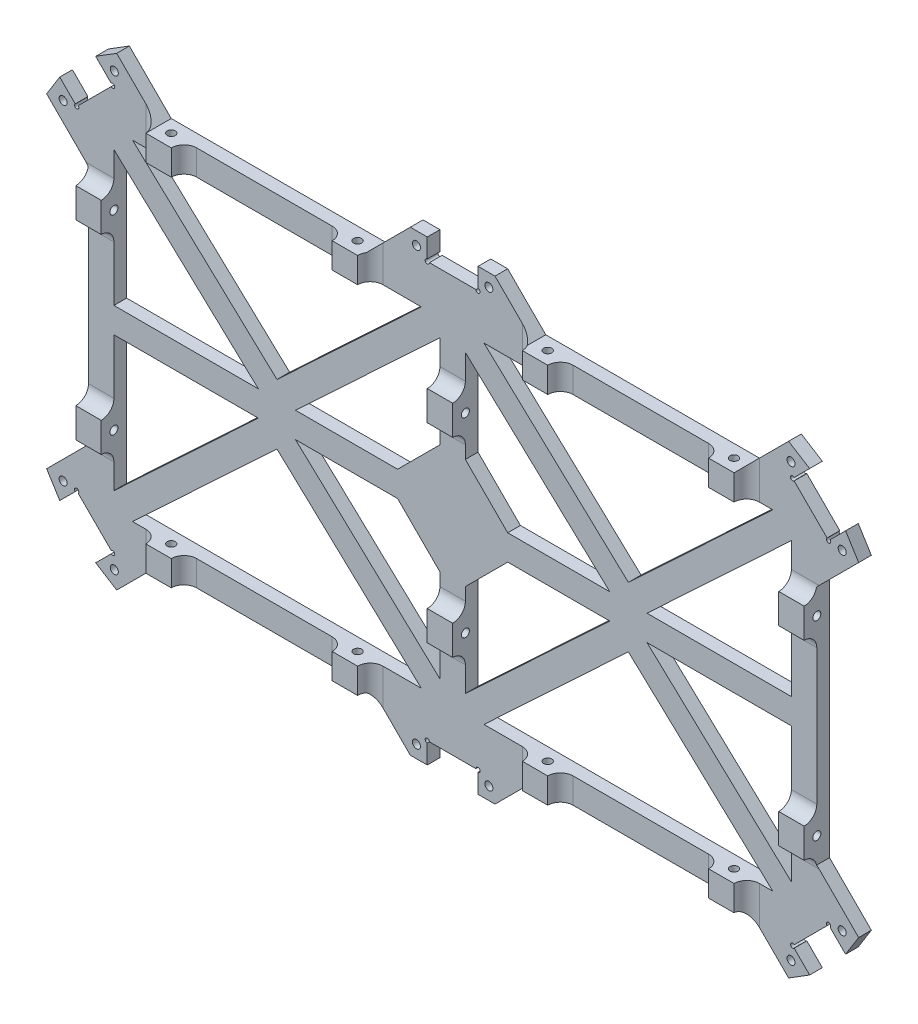
from build123d import *

# Parameters (mm, degrees)
ESQUISSE1_W             = 172
ESQUISSE1_H             = 90
BOSS_EXTRU_1_DEPTH      = 3
ESQUISSE2_R             = 0.95
BOSS_EXTRU_2_DEPTH      = 3
ESQUISSE6_W             = 6
ESQUISSE6_H             = 7
ESQUISSE6_H_2           = 6
BOSS_EXTRU_4_DEPTH      = 3
ENL_V_MAT_EXTRU_3_REACH = 140.593
ESQUISSE7_R             = 0.95
ENL_V_MAT_EXTRU_4_REACH = 140.593
ESQUISSE8_R             = 0.95
CONG_2_R                = 3
ENL_V_MAT_EXTRU_5_REACH = 192.084
ESQUISSE9_R             = 0.95
ENL_V_MAT_EXTRU_6_REACH = 115.259
ESQUISSE10_R            = 0.95
ENL_V_MAT_EXTRU_7_REACH = 186.351
ESQUISSE11_R            = 0.95
ENL_V_MAT_EXTRU_8_REACH = 112.527
ESQUISSE12_W            = 12
ESQUISSE12_H            = 7.192942245
ENL_V_MAT_EXTRU_9_REACH = 112.527
ESQUISSE13_R            = 0.5


with BuildPart() as part:
    # Esquisse1 → Boss.-Extru.1 (new body)
    with BuildSketch(Plane.XY):
        Rectangle(ESQUISSE1_W, ESQUISSE1_H)
        Polygon((-7.392425614, -39), (-75.607574386, -39), (-58.857104999, -23.337223431), (-58.701018232, -23.191272168), (-41.5, -7.107203172), align=None, mode=Mode.SUBTRACT)
        Polygon((-80, -34.892796828), (-80, -3), (-45.892425614, -3), (-62.798981768, -18.808727832), align=None, mode=Mode.SUBTRACT)
        Polygon((-3, -3), (-3, -34.892796828), (-37.107574386, -3), align=None, mode=Mode.SUBTRACT)
        Polygon((41.5, -7.107203172), (58.701018232, -23.191272168), (58.857104999, -23.337223431), (75.607574386, -39), (7.392425614, -39), align=None, mode=Mode.SUBTRACT)
        Polygon((37.107574386, -3), (3, -34.892796828), (3, -3), align=None, mode=Mode.SUBTRACT)
        Polygon((80, -34.892796828), (62.798981768, -18.808727832), (45.892425614, -3), (80, -3), align=None, mode=Mode.SUBTRACT)
        Polygon((-80, 3), (-80, 34.892796828), (-62.798981768, 18.808727832), (-45.892425614, 3), align=None, mode=Mode.SUBTRACT)
        Polygon((-34.550705308, 5.390838618), (-3, 34.892796828), (-3, 3), (-37.107574386, 3), align=None, mode=Mode.SUBTRACT)
        Polygon((-58.857104999, 23.337223431), (-75.607574386, 39), (-7.392425614, 39), (-41.5, 7.107203172), (-58.701018232, 23.191272168), align=None, mode=Mode.SUBTRACT)
        Polygon((3, 3), (3, 34.892796828), (34.550705308, 5.390838618), (37.107574386, 3), align=None, mode=Mode.SUBTRACT)
        Polygon((62.798981768, 18.808727832), (80, 34.892796828), (80, 3), (45.892425614, 3), align=None, mode=Mode.SUBTRACT)
        Polygon((75.607574386, 39), (58.857104999, 23.337223431), (58.701018232, 23.191272168), (41.5, 7.107203172), (7.392425614, 39), align=None, mode=Mode.SUBTRACT)
    extrude(amount=BOSS_EXTRU_1_DEPTH)

    # Esquisse2 → Boss.-Extru.2 (add)
    # profile 1 of 10: a face of its own
    with BuildSketch(Plane.XY.offset(3)):
        Polygon((-86, 45), (-69.45370132, 45), (-79.341722304, 54.888020984), (-89.535533906, 48.535533906), (-95.888020984, 38.341722304), (-86, 28.45370132), align=None)
        with Locations((-92, 38.908474042)):
            Circle(ESQUISSE2_R, mode=Mode.SUBTRACT)
        with Locations((-79.908474042, 51)):
            Circle(ESQUISSE2_R, mode=Mode.SUBTRACT)
    # profile 2 of 10: a face of its own
    with BuildSketch(Plane.XY.offset(3)):
        Polygon((-19, 45), (-10.3, 45), (10.3, 45), (19, 45), (10, 54), (0, 54), (-10, 54), align=None)
        with Locations((-8.55, 51)):
            Circle(ESQUISSE2_R, mode=Mode.SUBTRACT)
        with Locations((8.55, 51)):
            Circle(ESQUISSE2_R, mode=Mode.SUBTRACT)
    # profile 3 of 10: a face of its own
    with BuildSketch(Plane.XY.offset(3)):
        Polygon((79.341722304, 54.888020984), (69.45370132, 45), (86, 45), (86, 28.45370132), (95.888020984, 38.341722304), (89.535533906, 48.535533906), align=None)
        with Locations((92, 38.908474042)):
            Circle(ESQUISSE2_R, mode=Mode.SUBTRACT)
        with Locations((79.908474042, 51)):
            Circle(ESQUISSE2_R, mode=Mode.SUBTRACT)
    # profile 4 of 10: a face of its own
    with BuildSketch(Plane.XY.offset(3)):
        Polygon((95.888020984, -38.341722304), (86, -28.45370132), (86, -45), (69.45370132, -45), (79.341722304, -54.888020984), (89.535533906, -48.535533906), align=None)
        with Locations((79.908474042, -51)):
            Circle(ESQUISSE2_R, mode=Mode.SUBTRACT)
        with Locations((92, -38.908474042)):
            Circle(ESQUISSE2_R, mode=Mode.SUBTRACT)
    # profile 5 of 10: a face of its own
    with BuildSketch(Plane.XY.offset(3)):
        Polygon((19, -45), (-19, -45), (-10, -54), (0, -54), (10, -54), align=None)
        with Locations((-8.55, -51)):
            Circle(ESQUISSE2_R, mode=Mode.SUBTRACT)
        with Locations((8.55, -51)):
            Circle(ESQUISSE2_R, mode=Mode.SUBTRACT)
    # profile 6 of 10: a face of its own
    with BuildSketch(Plane.XY.offset(3)):
        Polygon((-86, -45), (-86, -28.45370132), (-95.888020984, -38.341722304), (-89.535533906, -48.535533906), (-79.341722304, -54.888020984), (-69.45370132, -45), align=None)
        with Locations((-79.908474042, -51)):
            Circle(ESQUISSE2_R, mode=Mode.SUBTRACT)
        with Locations((-92, -38.908474042)):
            Circle(ESQUISSE2_R, mode=Mode.SUBTRACT)
    # profile 7 of 10: a face of its own
    with BuildSketch(Plane.XY.offset(3)):
        Polygon((-3, -3), (-13, -3), (-3, -13), align=None)
    # profile 8 of 10: a face of its own
    with BuildSketch(Plane.XY.offset(3)):
        Polygon((3, -3), (3, -13), (13, -3), align=None)
    # profile 9 of 10: a face of its own
    with BuildSketch(Plane.XY.offset(3)):
        Polygon((13, 3), (3, 13), (3, 3), align=None)
    # profile 10 of 10: a face of its own
    with BuildSketch(Plane.XY.offset(3)):
        Polygon((-3, 13), (-13, 3), (-3, 3), align=None)
    extrude(amount=-BOSS_EXTRU_2_DEPTH)

    # Esquisse6 → Boss.-Extru.4 (add)
    with BuildSketch(Plane.XY.offset(3)):
        with Locations((-83, -22.5)):
            Rectangle(ESQUISSE6_W, ESQUISSE6_H)
        with Locations((-83, 22.5)):
            Rectangle(ESQUISSE6_W, ESQUISSE6_H)
        with Locations((83, -22.5)):
            Rectangle(ESQUISSE6_W, ESQUISSE6_H)
        with Locations((83, 22.5)):
            Rectangle(ESQUISSE6_W, ESQUISSE6_H)
        with Locations((-66.45370132, 42)):
            Rectangle(ESQUISSE6_W, ESQUISSE6_H_2)
        with Locations((22.45370132, 42)):
            Rectangle(ESQUISSE6_W, ESQUISSE6_H_2)
        with Locations((-22.45370132, 42)):
            Rectangle(ESQUISSE6_W, ESQUISSE6_H_2)
        with Locations((66.45370132, 42)):
            Rectangle(ESQUISSE6_W, ESQUISSE6_H_2)
        with Locations((66.45370132, -42)):
            Rectangle(ESQUISSE6_W, ESQUISSE6_H_2)
        with Locations((22.45370132, -42)):
            Rectangle(ESQUISSE6_W, ESQUISSE6_H_2)
        with Locations((-22.45370132, -42)):
            Rectangle(ESQUISSE6_W, ESQUISSE6_H_2)
        with Locations((-66.45370132, -42)):
            Rectangle(ESQUISSE6_W, ESQUISSE6_H_2)
        with Locations((0, 22.5)):
            Rectangle(ESQUISSE6_W, ESQUISSE6_H)
        with Locations((0, -22.5)):
            Rectangle(ESQUISSE6_W, ESQUISSE6_H)
    extrude(amount=BOSS_EXTRU_4_DEPTH)

    # Esquisse7 → Enlèv. mat.-Extru.3 (cut, up to next)
    with BuildSketch(Plane.XZ.offset(45), mode=Mode.PRIVATE) as enl_v_mat_extru_3_sk1:
        with Locations(Location((-66.45370132, 3, 0), (0, 0, 270))):
            Circle(ESQUISSE7_R)
    enl_v_mat_extru_3_tool1 = extrude(enl_v_mat_extru_3_sk1.sketch, amount=-ENL_V_MAT_EXTRU_3_REACH, mode=Mode.PRIVATE) & part.part
    # Esquisse7 → Enlèv. mat.-Extru.3 (cut, up to next)
    with BuildSketch(Plane.XZ.offset(45), mode=Mode.PRIVATE) as enl_v_mat_extru_3_sk2:
        with Locations(Location((-22.45370132, 3, 0), (0, 0, 270))):
            Circle(ESQUISSE7_R)
    enl_v_mat_extru_3_tool2 = extrude(enl_v_mat_extru_3_sk2.sketch, amount=-ENL_V_MAT_EXTRU_3_REACH, mode=Mode.PRIVATE) & part.part
    # Esquisse7 → Enlèv. mat.-Extru.3 (cut, up to next)
    with BuildSketch(Plane.XZ.offset(45), mode=Mode.PRIVATE) as enl_v_mat_extru_3_sk3:
        with Locations(Location((22.45370132, 3, 0), (0, 0, 270))):
            Circle(ESQUISSE7_R)
    enl_v_mat_extru_3_tool3 = extrude(enl_v_mat_extru_3_sk3.sketch, amount=-ENL_V_MAT_EXTRU_3_REACH, mode=Mode.PRIVATE) & part.part
    # Esquisse7 → Enlèv. mat.-Extru.3 (cut, up to next)
    with BuildSketch(Plane.XZ.offset(45), mode=Mode.PRIVATE) as enl_v_mat_extru_3_sk4:
        with Locations(Location((66.45370132, 3, 0), (0, 0, 270))):
            Circle(ESQUISSE7_R)
    enl_v_mat_extru_3_tool4 = extrude(enl_v_mat_extru_3_sk4.sketch, amount=-ENL_V_MAT_EXTRU_3_REACH, mode=Mode.PRIVATE) & part.part
    add(enl_v_mat_extru_3_tool1.solids().sort_by_distance((-66.453701, -45, 3))[0], mode=Mode.SUBTRACT)
    add(enl_v_mat_extru_3_tool2.solids().sort_by_distance((-22.453701, -45, 3))[0], mode=Mode.SUBTRACT)
    add(enl_v_mat_extru_3_tool3.solids().sort_by_distance((22.453701, -45, 3))[0], mode=Mode.SUBTRACT)
    add(enl_v_mat_extru_3_tool4.solids().sort_by_distance((66.453701, -45, 3))[0], mode=Mode.SUBTRACT)

    # Esquisse8 → Enlèv. mat.-Extru.4 (cut, up to next)
    with BuildSketch(Plane(origin=(0, 45, 0), x_dir=(1, 0, 0), z_dir=(0, 1, 0)), mode=Mode.PRIVATE) as enl_v_mat_extru_4_sk1:
        with Locations(Location((66.45370132, -3, 0), (0, 0, 90))):
            Circle(ESQUISSE8_R)
    enl_v_mat_extru_4_tool1 = extrude(enl_v_mat_extru_4_sk1.sketch, amount=-ENL_V_MAT_EXTRU_4_REACH, mode=Mode.PRIVATE) & part.part
    # Esquisse8 → Enlèv. mat.-Extru.4 (cut, up to next)
    with BuildSketch(Plane(origin=(0, 45, 0), x_dir=(1, 0, 0), z_dir=(0, 1, 0)), mode=Mode.PRIVATE) as enl_v_mat_extru_4_sk2:
        with Locations(Location((22.45370132, -3, 0), (0, 0, 90))):
            Circle(ESQUISSE8_R)
    enl_v_mat_extru_4_tool2 = extrude(enl_v_mat_extru_4_sk2.sketch, amount=-ENL_V_MAT_EXTRU_4_REACH, mode=Mode.PRIVATE) & part.part
    # Esquisse8 → Enlèv. mat.-Extru.4 (cut, up to next)
    with BuildSketch(Plane(origin=(0, 45, 0), x_dir=(1, 0, 0), z_dir=(0, 1, 0)), mode=Mode.PRIVATE) as enl_v_mat_extru_4_sk3:
        with Locations(Location((-22.45370132, -3, 0), (0, 0, 90))):
            Circle(ESQUISSE8_R)
    enl_v_mat_extru_4_tool3 = extrude(enl_v_mat_extru_4_sk3.sketch, amount=-ENL_V_MAT_EXTRU_4_REACH, mode=Mode.PRIVATE) & part.part
    # Esquisse8 → Enlèv. mat.-Extru.4 (cut, up to next)
    with BuildSketch(Plane(origin=(0, 45, 0), x_dir=(1, 0, 0), z_dir=(0, 1, 0)), mode=Mode.PRIVATE) as enl_v_mat_extru_4_sk4:
        with Locations(Location((-66.45370132, -3, 0), (0, 0, 90))):
            Circle(ESQUISSE8_R)
    enl_v_mat_extru_4_tool4 = extrude(enl_v_mat_extru_4_sk4.sketch, amount=-ENL_V_MAT_EXTRU_4_REACH, mode=Mode.PRIVATE) & part.part
    add(enl_v_mat_extru_4_tool1.solids().sort_by_distance((66.453701, 45, 3))[0], mode=Mode.SUBTRACT)
    add(enl_v_mat_extru_4_tool2.solids().sort_by_distance((22.453701, 45, 3))[0], mode=Mode.SUBTRACT)
    add(enl_v_mat_extru_4_tool3.solids().sort_by_distance((-22.453701, 45, 3))[0], mode=Mode.SUBTRACT)
    add(enl_v_mat_extru_4_tool4.solids().sort_by_distance((-66.453701, 45, 3))[0], mode=Mode.SUBTRACT)

    # Congé2
    # the kernel refuses this fillet: 3 mm, written as the material it adds along each edge
    with BuildSketch(Plane(origin=(-80, -26, 3), x_dir=(0, -1, 0), z_dir=(-1, 0, 0))) as cong_2_piece_1_section:
        with BuildLine():
            CenterArc((CONG_2_R, CONG_2_R), CONG_2_R, 180, 90)
            Line((0, CONG_2_R), (0, 0))
            Line((0, 0), (CONG_2_R, 0))
        make_face()
    cong_2_piece_1 = extrude(amount=13.5, mode=Mode.PRIVATE)
    cong_2_piece_1 = split(cong_2_piece_1, bisect_by=Plane(origin=(-83.218138122, -25.671839442, 3.626048743), z_dir=(0.7071067811865461, -0.7071067811865489, 0)), keep=Keep.TOP, mode=Mode.PRIVATE)
    add(cong_2_piece_1)
    with BuildSketch(Plane(origin=(-80, -26, 3), x_dir=(0, -1, 0), z_dir=(-1, 0, 0)), Plane(origin=(-86, -19, 3), x_dir=(0, 1, 0), z_dir=(1, 0, 0)), Plane(origin=(-86, 26, 3), x_dir=(0, 1, 0), z_dir=(1, 0, 0)), Plane(origin=(-80, 19, 3), x_dir=(0, -1, 0), z_dir=(-1, 0, 0)), Plane(origin=(86, -26, 3), x_dir=(0, -1, 0), z_dir=(-1, 0, 0)), Plane(origin=(80, -19, 3), x_dir=(0, 1, 0), z_dir=(1, 0, 0)), Plane(origin=(80, 26, 3), x_dir=(0, 1, 0), z_dir=(1, 0, 0)), Plane(origin=(86, 19, 3), x_dir=(0, -1, 0), z_dir=(-1, 0, 0)), Plane(origin=(-19.45370132, 45, 3), x_dir=(1, 0, 0), z_dir=(0, -1, 0)), Plane(origin=(63.45370132, 45, 3), x_dir=(0, 0, 1), z_dir=(0, -1, 0)), Plane(origin=(19.45370132, -45, 3), x_dir=(-1, 0, 0), z_dir=(0, 1, 0)), Plane(origin=(-63.45370132, -45, 3), x_dir=(0, 0, 1), z_dir=(0, 1, 0)), Plane(origin=(3, 19, 3), x_dir=(0, -1, 0), z_dir=(-1, 0, 0)), Plane(origin=(-3, 26, 3), x_dir=(0, 1, 0), z_dir=(1, 0, 0))) as cong_2_piece_2:
        with BuildLine():
            CenterArc((CONG_2_R, CONG_2_R), CONG_2_R, 180, 90)
            Line((0, CONG_2_R), (0, 0))
            Line((0, 0), (CONG_2_R, 0))
        make_face()
    extrude(amount=6)
    with BuildSketch(Plane(origin=(-93.5, 26, 3), x_dir=(0, 1, 0), z_dir=(1, 0, 0))) as cong_2_piece_3_section:
        with BuildLine():
            CenterArc((CONG_2_R, CONG_2_R), CONG_2_R, 180, 90)
            Line((0, CONG_2_R), (0, 0))
            Line((0, 0), (CONG_2_R, 0))
        make_face()
    cong_2_piece_3 = extrude(amount=13.5, mode=Mode.PRIVATE)
    cong_2_piece_3 = split(cong_2_piece_3, bisect_by=Plane(origin=(-86.163732674, 28.617433994, 3.010004121), z_dir=(0.7071067811865461, 0.7071067811865489, 0)), keep=Keep.TOP, mode=Mode.PRIVATE)
    add(cong_2_piece_3)
    with BuildSketch(Plane(origin=(93.5, -26, 3), x_dir=(0, -1, 0), z_dir=(-1, 0, 0))) as cong_2_piece_4_section:
        with BuildLine():
            CenterArc((CONG_2_R, CONG_2_R), CONG_2_R, 180, 90)
            Line((0, CONG_2_R), (0, 0))
            Line((0, 0), (CONG_2_R, 0))
        make_face()
    cong_2_piece_4 = extrude(amount=13.5, mode=Mode.PRIVATE)
    cong_2_piece_4 = split(cong_2_piece_4, bisect_by=Plane(origin=(86.163732674, -28.617433994, 3.010004121), z_dir=(-0.7071067811865459, -0.7071067811865491, 0)), keep=Keep.TOP, mode=Mode.PRIVATE)
    add(cong_2_piece_4)
    with BuildSketch(Plane(origin=(80, 26, 3), x_dir=(0, 1, 0), z_dir=(1, 0, 0))) as cong_2_piece_5_section:
        with BuildLine():
            CenterArc((CONG_2_R, CONG_2_R), CONG_2_R, 180, 90)
            Line((0, CONG_2_R), (0, 0))
            Line((0, 0), (CONG_2_R, 0))
        make_face()
    cong_2_piece_5 = extrude(amount=13.5, mode=Mode.PRIVATE)
    cong_2_piece_5 = split(cong_2_piece_5, bisect_by=Plane(origin=(83.218138122, 25.671839442, 3.626048743), z_dir=(-0.7071067811865459, 0.7071067811865491, 0)), keep=Keep.TOP, mode=Mode.PRIVATE)
    add(cong_2_piece_5)
    with BuildSketch(Plane(origin=(-69.45370132, 39, 3), x_dir=(-1, 0, 0), z_dir=(0, 1, 0))) as cong_2_piece_6_section:
        with BuildLine():
            CenterArc((CONG_2_R, CONG_2_R), CONG_2_R, 180, 90)
            Line((0, CONG_2_R), (0, 0))
            Line((0, 0), (CONG_2_R, 0))
        make_face()
    cong_2_piece_6 = extrude(amount=13.5, mode=Mode.PRIVATE)
    cong_2_piece_6 = split(cong_2_piece_6, bisect_by=Plane(origin=(-68.288753229, 43.835051908, 3.670103817), z_dir=(-0.7071067811865387, -0.7071067811865565, 0)), keep=Keep.TOP, mode=Mode.PRIVATE)
    add(cong_2_piece_6)
    with BuildSketch(Plane(origin=(-63.45370132, 45, 3), x_dir=(0, 0, 1), z_dir=(0, -1, 0)), Plane(origin=(-25.45370132, 39, 3), x_dir=(0, 0, 1), z_dir=(0, 1, 0)), Plane(origin=(19.45370132, 45, 3), x_dir=(-1, 0, 0), z_dir=(0, -1, 0)), Plane(origin=(25.45370132, 39, 3), x_dir=(1, 0, 0), z_dir=(0, 1, 0)), Plane(origin=(63.45370132, -45, 3), x_dir=(0, 0, 1), z_dir=(0, 1, 0)), Plane(origin=(25.45370132, -39, 3), x_dir=(0, 0, 1), z_dir=(0, -1, 0)), Plane(origin=(-19.45370132, -45, 3), x_dir=(1, 0, 0), z_dir=(0, 1, 0)), Plane(origin=(-25.45370132, -39, 3), x_dir=(-1, 0, 0), z_dir=(0, -1, 0)), Plane(origin=(-3, -26, 3), x_dir=(0, -1, 0), z_dir=(1, 0, 0)), Plane(origin=(3, -19, 3), x_dir=(0, 1, 0), z_dir=(-1, 0, 0))) as cong_2_piece_7:
        with BuildLine():
            CenterArc((CONG_2_R, -CONG_2_R), CONG_2_R, 90, 90)
            Line((0, -CONG_2_R), (0, 0))
            Line((0, 0), (CONG_2_R, 0))
        make_face()
    extrude(amount=6)
    with BuildSketch(Plane(origin=(-19.45370132, 52.5, 3), x_dir=(1, 0, 0), z_dir=(0, -1, 0))) as cong_2_piece_8_section:
        with BuildLine():
            CenterArc((CONG_2_R, CONG_2_R), CONG_2_R, 180, 90)
            Line((0, CONG_2_R), (0, 0))
            Line((0, 0), (CONG_2_R, 0))
        make_face()
    cong_2_piece_8 = extrude(amount=13.5, mode=Mode.PRIVATE)
    cong_2_piece_8 = split(cong_2_piece_8, bisect_by=Plane(origin=(-18.257356952, 45.742643048, 3.253081686), z_dir=(0.7071067811865465, -0.7071067811865487, 0)), keep=Keep.TOP, mode=Mode.PRIVATE)
    add(cong_2_piece_8)
    with BuildSketch(Plane(origin=(19.45370132, 52.5, 3), x_dir=(-1, 0, 0), z_dir=(0, -1, 0))) as cong_2_piece_9_section:
        with BuildLine():
            CenterArc((CONG_2_R, -CONG_2_R), CONG_2_R, 90, 90)
            Line((0, -CONG_2_R), (0, 0))
            Line((0, 0), (CONG_2_R, 0))
        make_face()
    cong_2_piece_9 = extrude(amount=13.5, mode=Mode.PRIVATE)
    cong_2_piece_9 = split(cong_2_piece_9, bisect_by=Plane(origin=(18.257356952, 45.742643048, 3.253081686), z_dir=(-0.7071067811865482, -0.7071067811865469, 0)), keep=Keep.TOP, mode=Mode.PRIVATE)
    add(cong_2_piece_9)
    with BuildSketch(Plane(origin=(69.45370132, 39, 3), x_dir=(1, 0, 0), z_dir=(0, 1, 0))) as cong_2_piece_10_section:
        with BuildLine():
            CenterArc((CONG_2_R, -CONG_2_R), CONG_2_R, 90, 90)
            Line((0, -CONG_2_R), (0, 0))
            Line((0, 0), (CONG_2_R, 0))
        make_face()
    cong_2_piece_10 = extrude(amount=13.5, mode=Mode.PRIVATE)
    cong_2_piece_10 = split(cong_2_piece_10, bisect_by=Plane(origin=(68.288753229, 43.835051908, 3.670103817), z_dir=(0.7071067811865387, -0.7071067811865565, 0)), keep=Keep.TOP, mode=Mode.PRIVATE)
    add(cong_2_piece_10)
    with BuildSketch(Plane(origin=(69.45370132, -39, 3), x_dir=(1, 0, 0), z_dir=(0, -1, 0))) as cong_2_piece_11_section:
        with BuildLine():
            CenterArc((CONG_2_R, CONG_2_R), CONG_2_R, 180, 90)
            Line((0, CONG_2_R), (0, 0))
            Line((0, 0), (CONG_2_R, 0))
        make_face()
    cong_2_piece_11 = extrude(amount=13.5, mode=Mode.PRIVATE)
    cong_2_piece_11 = split(cong_2_piece_11, bisect_by=Plane(origin=(68.288753229, -43.835051908, 3.670103817), z_dir=(0.7071067811865387, 0.7071067811865565, 0)), keep=Keep.TOP, mode=Mode.PRIVATE)
    add(cong_2_piece_11)
    with BuildSketch(Plane(origin=(19.45370132, -52.5, 3), x_dir=(-1, 0, 0), z_dir=(0, 1, 0))) as cong_2_piece_12_section:
        with BuildLine():
            CenterArc((CONG_2_R, CONG_2_R), CONG_2_R, 180, 90)
            Line((0, CONG_2_R), (0, 0))
            Line((0, 0), (CONG_2_R, 0))
        make_face()
    cong_2_piece_12 = extrude(amount=13.5, mode=Mode.PRIVATE)
    cong_2_piece_12 = split(cong_2_piece_12, bisect_by=Plane(origin=(18.257356952, -45.742643048, 3.253081686), z_dir=(-0.7071067811865482, 0.7071067811865469, 0)), keep=Keep.TOP, mode=Mode.PRIVATE)
    add(cong_2_piece_12)
    with BuildSketch(Plane(origin=(-19.45370132, -52.5, 3), x_dir=(1, 0, 0), z_dir=(0, 1, 0))) as cong_2_piece_13_section:
        with BuildLine():
            CenterArc((CONG_2_R, -CONG_2_R), CONG_2_R, 90, 90)
            Line((0, -CONG_2_R), (0, 0))
            Line((0, 0), (CONG_2_R, 0))
        make_face()
    cong_2_piece_13 = extrude(amount=13.5, mode=Mode.PRIVATE)
    cong_2_piece_13 = split(cong_2_piece_13, bisect_by=Plane(origin=(-18.257356952, -45.742643048, 3.253081686), z_dir=(0.7071067811865465, 0.7071067811865487, 0)), keep=Keep.TOP, mode=Mode.PRIVATE)
    add(cong_2_piece_13)
    with BuildSketch(Plane(origin=(-69.45370132, -39, 3), x_dir=(-1, 0, 0), z_dir=(0, -1, 0))) as cong_2_piece_14_section:
        with BuildLine():
            CenterArc((CONG_2_R, -CONG_2_R), CONG_2_R, 90, 90)
            Line((0, -CONG_2_R), (0, 0))
            Line((0, 0), (CONG_2_R, 0))
        make_face()
    cong_2_piece_14 = extrude(amount=13.5, mode=Mode.PRIVATE)
    cong_2_piece_14 = split(cong_2_piece_14, bisect_by=Plane(origin=(-68.288753229, -43.835051908, 3.670103817), z_dir=(-0.7071067811865387, 0.7071067811865565, 0)), keep=Keep.TOP, mode=Mode.PRIVATE)
    add(cong_2_piece_14)

    # Esquisse9 → Enlèv. mat.-Extru.5 (cut, up to next)
    with BuildSketch(Plane.ZY.offset(86), mode=Mode.PRIVATE) as enl_v_mat_extru_5_sk1:
        with Locations(Location((3, -22.5, 0), (0, 0, 270))):
            Circle(ESQUISSE9_R)
    enl_v_mat_extru_5_tool1 = extrude(enl_v_mat_extru_5_sk1.sketch, amount=-ENL_V_MAT_EXTRU_5_REACH, mode=Mode.PRIVATE) & part.part
    # Esquisse9 → Enlèv. mat.-Extru.5 (cut, up to next)
    with BuildSketch(Plane.ZY.offset(86), mode=Mode.PRIVATE) as enl_v_mat_extru_5_sk2:
        with Locations(Location((3, 22.5, 0), (0, 0, 270))):
            Circle(ESQUISSE9_R)
    enl_v_mat_extru_5_tool2 = extrude(enl_v_mat_extru_5_sk2.sketch, amount=-ENL_V_MAT_EXTRU_5_REACH, mode=Mode.PRIVATE) & part.part
    add(enl_v_mat_extru_5_tool1.solids().sort_by_distance((-86, -22.5, 3))[0], mode=Mode.SUBTRACT)
    add(enl_v_mat_extru_5_tool2.solids().sort_by_distance((-86, 22.5, 3))[0], mode=Mode.SUBTRACT)

    # Esquisse10 → Enlèv. mat.-Extru.6 (cut, up to next)
    with BuildSketch(Plane.ZY.offset(3), mode=Mode.PRIVATE) as enl_v_mat_extru_6_sk1:
        with Locations(Location((3, -22.5, 0), (0, 0, 270))):
            Circle(ESQUISSE10_R)
    enl_v_mat_extru_6_tool1 = extrude(enl_v_mat_extru_6_sk1.sketch, amount=-ENL_V_MAT_EXTRU_6_REACH, mode=Mode.PRIVATE) & part.part
    # Esquisse10 → Enlèv. mat.-Extru.6 (cut, up to next)
    with BuildSketch(Plane.ZY.offset(3), mode=Mode.PRIVATE) as enl_v_mat_extru_6_sk2:
        with Locations(Location((3, 22.5, 0), (0, 0, 270))):
            Circle(ESQUISSE10_R)
    enl_v_mat_extru_6_tool2 = extrude(enl_v_mat_extru_6_sk2.sketch, amount=-ENL_V_MAT_EXTRU_6_REACH, mode=Mode.PRIVATE) & part.part
    add(enl_v_mat_extru_6_tool1.solids().sort_by_distance((-3, -22.5, 3))[0], mode=Mode.SUBTRACT)
    add(enl_v_mat_extru_6_tool2.solids().sort_by_distance((-3, 22.5, 3))[0], mode=Mode.SUBTRACT)

    # Esquisse11 → Enlèv. mat.-Extru.7 (cut, up to next)
    with BuildSketch(Plane.ZY.offset(-80), mode=Mode.PRIVATE) as enl_v_mat_extru_7_sk1:
        with Locations(Location((3, 22.5, 0), (0, 0, 270))):
            Circle(ESQUISSE11_R)
    enl_v_mat_extru_7_tool1 = extrude(enl_v_mat_extru_7_sk1.sketch, amount=-ENL_V_MAT_EXTRU_7_REACH, mode=Mode.PRIVATE) & part.part
    # Esquisse11 → Enlèv. mat.-Extru.7 (cut, up to next)
    with BuildSketch(Plane.ZY.offset(-80), mode=Mode.PRIVATE) as enl_v_mat_extru_7_sk2:
        with Locations(Location((3, -22.473199207, 0), (0, 0, 270))):
            Circle(ESQUISSE11_R)
    enl_v_mat_extru_7_tool2 = extrude(enl_v_mat_extru_7_sk2.sketch, amount=-ENL_V_MAT_EXTRU_7_REACH, mode=Mode.PRIVATE) & part.part
    add(enl_v_mat_extru_7_tool1.solids().sort_by_distance((80, 22.5, 3))[0], mode=Mode.SUBTRACT)
    add(enl_v_mat_extru_7_tool2.solids().sort_by_distance((80, -22.473199, 3))[0], mode=Mode.SUBTRACT)

    # Esquisse12 → Enlèv. mat.-Extru.8 (cut, up to next)
    with BuildSketch(Plane.XY.offset(3), mode=Mode.PRIVATE) as enl_v_mat_extru_8_sk1:
        Polygon((-88.782664146, -39.297382771), (-80.297382771, -47.782664146), (-86.661343802, -54.146625176), (-95.146625176, -45.661343802), align=None)
    enl_v_mat_extru_8_tool1 = extrude(enl_v_mat_extru_8_sk1.sketch, amount=-ENL_V_MAT_EXTRU_8_REACH, mode=Mode.PRIVATE) & part.part
    # Esquisse12 → Enlèv. mat.-Extru.8 (cut, up to next)
    with BuildSketch(Plane.XY.offset(3), mode=Mode.PRIVATE) as enl_v_mat_extru_8_sk2:
        with Locations((0, -52.596471123)):
            Rectangle(ESQUISSE12_W, ESQUISSE12_H)
    enl_v_mat_extru_8_tool2 = extrude(enl_v_mat_extru_8_sk2.sketch, amount=-ENL_V_MAT_EXTRU_8_REACH, mode=Mode.PRIVATE) & part.part
    # Esquisse12 → Enlèv. mat.-Extru.8 (cut, up to next)
    with BuildSketch(Plane.XY.offset(3), mode=Mode.PRIVATE) as enl_v_mat_extru_8_sk3:
        Polygon((95.146625176, -45.661343802), (86.661343802, -54.146625176), (80.297382771, -47.782664146), (88.782664146, -39.297382771), align=None)
    enl_v_mat_extru_8_tool3 = extrude(enl_v_mat_extru_8_sk3.sketch, amount=-ENL_V_MAT_EXTRU_8_REACH, mode=Mode.PRIVATE) & part.part
    # Esquisse12 → Enlèv. mat.-Extru.8 (cut, up to next)
    with BuildSketch(Plane.XY.offset(3), mode=Mode.PRIVATE) as enl_v_mat_extru_8_sk4:
        Polygon((88.782664146, 39.297382771), (80.297382771, 47.782664146), (86.661343802, 54.146625176), (95.146625176, 45.661343802), align=None)
    enl_v_mat_extru_8_tool4 = extrude(enl_v_mat_extru_8_sk4.sketch, amount=-ENL_V_MAT_EXTRU_8_REACH, mode=Mode.PRIVATE) & part.part
    # Esquisse12 → Enlèv. mat.-Extru.8 (cut, up to next)
    with BuildSketch(Plane.XY.offset(3), mode=Mode.PRIVATE) as enl_v_mat_extru_8_sk5:
        with Locations((0, 52.596471123)):
            Rectangle(ESQUISSE12_W, ESQUISSE12_H)
    enl_v_mat_extru_8_tool5 = extrude(enl_v_mat_extru_8_sk5.sketch, amount=-ENL_V_MAT_EXTRU_8_REACH, mode=Mode.PRIVATE) & part.part
    # Esquisse12 → Enlèv. mat.-Extru.8 (cut, up to next)
    with BuildSketch(Plane.XY.offset(3), mode=Mode.PRIVATE) as enl_v_mat_extru_8_sk6:
        Polygon((-95.146625176, 45.661343802), (-86.661343802, 54.146625176), (-80.297382771, 47.782664146), (-88.782664146, 39.297382771), align=None)
    enl_v_mat_extru_8_tool6 = extrude(enl_v_mat_extru_8_sk6.sketch, amount=-ENL_V_MAT_EXTRU_8_REACH, mode=Mode.PRIVATE) & part.part
    add(enl_v_mat_extru_8_tool1.solids().sort_by_distance((-87.722004, -46.722004, 3))[0], mode=Mode.SUBTRACT)
    add(enl_v_mat_extru_8_tool2.solids().sort_by_distance((0, -52.596471, 3))[0], mode=Mode.SUBTRACT)
    add(enl_v_mat_extru_8_tool3.solids().sort_by_distance((87.722004, -46.722004, 3))[0], mode=Mode.SUBTRACT)
    add(enl_v_mat_extru_8_tool4.solids().sort_by_distance((87.722004, 46.722004, 3))[0], mode=Mode.SUBTRACT)
    add(enl_v_mat_extru_8_tool5.solids().sort_by_distance((0, 52.596471, 3))[0], mode=Mode.SUBTRACT)
    add(enl_v_mat_extru_8_tool6.solids().sort_by_distance((-87.722004, 46.722004, 3))[0], mode=Mode.SUBTRACT)

    # Esquisse13 → Enlèv. mat.-Extru.9 (cut, up to next)
    with BuildSketch(Plane.XY.offset(3), mode=Mode.PRIVATE) as enl_v_mat_extru_9_sk1:
        with Locations((-6, -49)):
            Circle(ESQUISSE13_R)
    enl_v_mat_extru_9_tool1 = extrude(enl_v_mat_extru_9_sk1.sketch, amount=-ENL_V_MAT_EXTRU_9_REACH, mode=Mode.PRIVATE) & part.part
    # Esquisse13 → Enlèv. mat.-Extru.9 (cut, up to next)
    with BuildSketch(Plane.XY.offset(3), mode=Mode.PRIVATE) as enl_v_mat_extru_9_sk2:
        with Locations((6, -49)):
            Circle(ESQUISSE13_R)
    enl_v_mat_extru_9_tool2 = extrude(enl_v_mat_extru_9_sk2.sketch, amount=-ENL_V_MAT_EXTRU_9_REACH, mode=Mode.PRIVATE) & part.part
    # Esquisse13 → Enlèv. mat.-Extru.9 (cut, up to next)
    with BuildSketch(Plane.XY.offset(3), mode=Mode.PRIVATE) as enl_v_mat_extru_9_sk3:
        with Locations((80.297382771, -47.782664146)):
            Circle(ESQUISSE13_R)
    enl_v_mat_extru_9_tool3 = extrude(enl_v_mat_extru_9_sk3.sketch, amount=-ENL_V_MAT_EXTRU_9_REACH, mode=Mode.PRIVATE) & part.part
    # Esquisse13 → Enlèv. mat.-Extru.9 (cut, up to next)
    with BuildSketch(Plane.XY.offset(3), mode=Mode.PRIVATE) as enl_v_mat_extru_9_sk4:
        with Locations((88.782664146, -39.297382771)):
            Circle(ESQUISSE13_R)
    enl_v_mat_extru_9_tool4 = extrude(enl_v_mat_extru_9_sk4.sketch, amount=-ENL_V_MAT_EXTRU_9_REACH, mode=Mode.PRIVATE) & part.part
    # Esquisse13 → Enlèv. mat.-Extru.9 (cut, up to next)
    with BuildSketch(Plane.XY.offset(3), mode=Mode.PRIVATE) as enl_v_mat_extru_9_sk5:
        with Locations((-88.782664146, -39.297382771)):
            Circle(ESQUISSE13_R)
    enl_v_mat_extru_9_tool5 = extrude(enl_v_mat_extru_9_sk5.sketch, amount=-ENL_V_MAT_EXTRU_9_REACH, mode=Mode.PRIVATE) & part.part
    # Esquisse13 → Enlèv. mat.-Extru.9 (cut, up to next)
    with BuildSketch(Plane.XY.offset(3), mode=Mode.PRIVATE) as enl_v_mat_extru_9_sk6:
        with Locations((-80.297382771, -47.782664146)):
            Circle(ESQUISSE13_R)
    enl_v_mat_extru_9_tool6 = extrude(enl_v_mat_extru_9_sk6.sketch, amount=-ENL_V_MAT_EXTRU_9_REACH, mode=Mode.PRIVATE) & part.part
    # Esquisse13 → Enlèv. mat.-Extru.9 (cut, up to next)
    with BuildSketch(Plane.XY.offset(3), mode=Mode.PRIVATE) as enl_v_mat_extru_9_sk7:
        with Locations((-80.297382771, 47.782664146)):
            Circle(ESQUISSE13_R)
    enl_v_mat_extru_9_tool7 = extrude(enl_v_mat_extru_9_sk7.sketch, amount=-ENL_V_MAT_EXTRU_9_REACH, mode=Mode.PRIVATE) & part.part
    # Esquisse13 → Enlèv. mat.-Extru.9 (cut, up to next)
    with BuildSketch(Plane.XY.offset(3), mode=Mode.PRIVATE) as enl_v_mat_extru_9_sk8:
        with Locations((-88.782664146, 39.297382771)):
            Circle(ESQUISSE13_R)
    enl_v_mat_extru_9_tool8 = extrude(enl_v_mat_extru_9_sk8.sketch, amount=-ENL_V_MAT_EXTRU_9_REACH, mode=Mode.PRIVATE) & part.part
    # Esquisse13 → Enlèv. mat.-Extru.9 (cut, up to next)
    with BuildSketch(Plane.XY.offset(3), mode=Mode.PRIVATE) as enl_v_mat_extru_9_sk9:
        with Locations((88.782664146, 39.297382771)):
            Circle(ESQUISSE13_R)
    enl_v_mat_extru_9_tool9 = extrude(enl_v_mat_extru_9_sk9.sketch, amount=-ENL_V_MAT_EXTRU_9_REACH, mode=Mode.PRIVATE) & part.part
    # Esquisse13 → Enlèv. mat.-Extru.9 (cut, up to next)
    with BuildSketch(Plane.XY.offset(3), mode=Mode.PRIVATE) as enl_v_mat_extru_9_sk10:
        with Locations((80.297382771, 47.782664146)):
            Circle(ESQUISSE13_R)
    enl_v_mat_extru_9_tool10 = extrude(enl_v_mat_extru_9_sk10.sketch, amount=-ENL_V_MAT_EXTRU_9_REACH, mode=Mode.PRIVATE) & part.part
    # Esquisse13 → Enlèv. mat.-Extru.9 (cut, up to next)
    with BuildSketch(Plane.XY.offset(3), mode=Mode.PRIVATE) as enl_v_mat_extru_9_sk11:
        with Locations((6, 49)):
            Circle(ESQUISSE13_R)
    enl_v_mat_extru_9_tool11 = extrude(enl_v_mat_extru_9_sk11.sketch, amount=-ENL_V_MAT_EXTRU_9_REACH, mode=Mode.PRIVATE) & part.part
    # Esquisse13 → Enlèv. mat.-Extru.9 (cut, up to next)
    with BuildSketch(Plane.XY.offset(3), mode=Mode.PRIVATE) as enl_v_mat_extru_9_sk12:
        with Locations((-6, 49)):
            Circle(ESQUISSE13_R)
    enl_v_mat_extru_9_tool12 = extrude(enl_v_mat_extru_9_sk12.sketch, amount=-ENL_V_MAT_EXTRU_9_REACH, mode=Mode.PRIVATE) & part.part
    add(enl_v_mat_extru_9_tool1.solids().sort_by_distance((-6, -49, 3))[0], mode=Mode.SUBTRACT)
    add(enl_v_mat_extru_9_tool2.solids().sort_by_distance((6, -49, 3))[0], mode=Mode.SUBTRACT)
    add(enl_v_mat_extru_9_tool3.solids().sort_by_distance((80.297383, -47.782664, 3))[0], mode=Mode.SUBTRACT)
    add(enl_v_mat_extru_9_tool4.solids().sort_by_distance((88.782664, -39.297383, 3))[0], mode=Mode.SUBTRACT)
    add(enl_v_mat_extru_9_tool5.solids().sort_by_distance((-88.782664, -39.297383, 3))[0], mode=Mode.SUBTRACT)
    add(enl_v_mat_extru_9_tool6.solids().sort_by_distance((-80.297383, -47.782664, 3))[0], mode=Mode.SUBTRACT)
    add(enl_v_mat_extru_9_tool7.solids().sort_by_distance((-80.297383, 47.782664, 3))[0], mode=Mode.SUBTRACT)
    add(enl_v_mat_extru_9_tool8.solids().sort_by_distance((-88.782664, 39.297383, 3))[0], mode=Mode.SUBTRACT)
    add(enl_v_mat_extru_9_tool9.solids().sort_by_distance((88.782664, 39.297383, 3))[0], mode=Mode.SUBTRACT)
    add(enl_v_mat_extru_9_tool10.solids().sort_by_distance((80.297383, 47.782664, 3))[0], mode=Mode.SUBTRACT)
    add(enl_v_mat_extru_9_tool11.solids().sort_by_distance((6, 49, 3))[0], mode=Mode.SUBTRACT)
    add(enl_v_mat_extru_9_tool12.solids().sort_by_distance((-6, 49, 3))[0], mode=Mode.SUBTRACT)


solid = part.part
